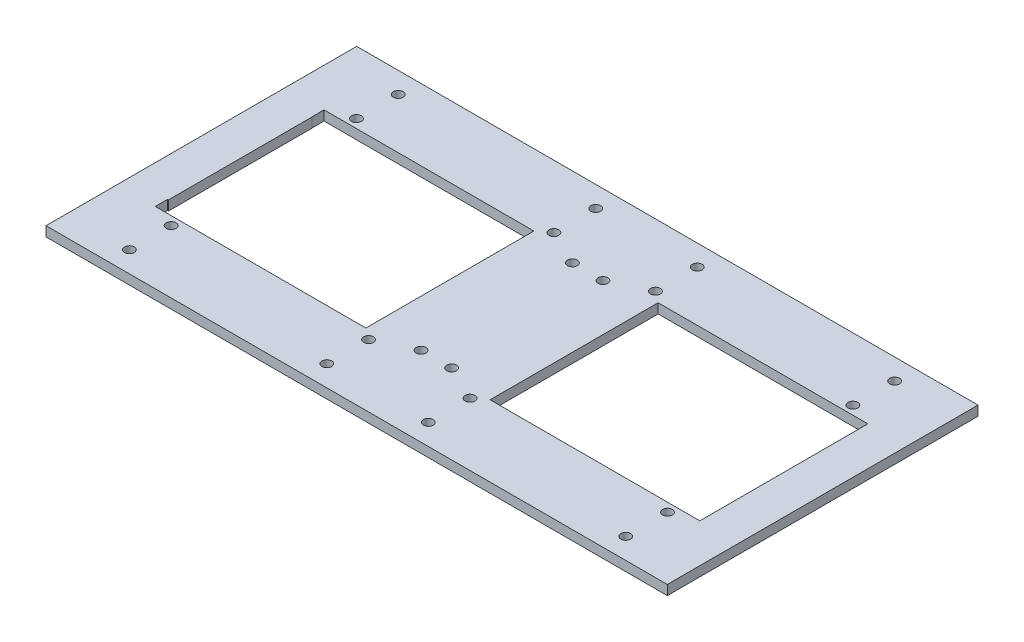
from build123d import *

# Parameters (mm, degrees)
SKETCH1_W           = 203.2
SKETCH1_H           = 101.6
SKETCH1_R           = 1.6
SKETCH1_W_2         = 68.58
SKETCH1_H_2         = 54.953705786
BOSS_EXTRUDE1_DEPTH = 3.175


with BuildPart() as part:
    # Sketch1 → Boss-Extrude1 (new body)
    with BuildSketch(Plane(origin=(0, 0, 0), x_dir=(1, 0, 0), z_dir=(0, 1, 0))):
        with Locations((101.6, -50.8)):
            Rectangle(SKETCH1_W, SKETCH1_H)
        Polygon((12.648382796, -23.323147107), (81.28, -23.323147107), (81.28, -78.276852893), (12.405089541, -78.276852893), (12.405089541, -74.276852893), (12.7, -74.276852893), (12.7, -27.323147107), (12.648382796, -27.323147107), align=None, mode=Mode.SUBTRACT)
        with Locations((20.431013284, -6.830786777)):
            Circle(SKETCH1_R, mode=Mode.SUBTRACT)
        with Locations((20.431013284, -20.49236033)):
            Circle(SKETCH1_R, mode=Mode.SUBTRACT)
        with Locations((85, -6.830786777)):
            Circle(SKETCH1_R, mode=Mode.SUBTRACT)
        with Locations((96.6, -26.05)):
            Circle(SKETCH1_R, mode=Mode.SUBTRACT)
        with Locations((85, -20.49236033)):
            Circle(SKETCH1_R, mode=Mode.SUBTRACT)
        with Locations((20.431013284, -94.769213223)):
            Circle(SKETCH1_R, mode=Mode.SUBTRACT)
        with Locations((20.431013284, -81.10763967)):
            Circle(SKETCH1_R, mode=Mode.SUBTRACT)
        with Locations((156.21, -50.8)):
            Rectangle(SKETCH1_W_2, SKETCH1_H_2, mode=Mode.SUBTRACT)
        with Locations((106.6, -26.05)):
            Circle(SKETCH1_R, mode=Mode.SUBTRACT)
        with Locations((118.2, -20.49236033)):
            Circle(SKETCH1_R, mode=Mode.SUBTRACT)
        with Locations((118.2, -6.830786777)):
            Circle(SKETCH1_R, mode=Mode.SUBTRACT)
        with Locations((85, -81.10763967)):
            Circle(SKETCH1_R, mode=Mode.SUBTRACT)
        with Locations((96.6, -75.55)):
            Circle(SKETCH1_R, mode=Mode.SUBTRACT)
        with Locations((85, -94.769213223)):
            Circle(SKETCH1_R, mode=Mode.SUBTRACT)
        with Locations((182.768986716, -20.49236033)):
            Circle(SKETCH1_R, mode=Mode.SUBTRACT)
        with Locations((182.768986716, -6.830786777)):
            Circle(SKETCH1_R, mode=Mode.SUBTRACT)
        with Locations((118.2, -94.769213223)):
            Circle(SKETCH1_R, mode=Mode.SUBTRACT)
        with Locations((106.6, -75.55)):
            Circle(SKETCH1_R, mode=Mode.SUBTRACT)
        with Locations((118.2, -81.10763967)):
            Circle(SKETCH1_R, mode=Mode.SUBTRACT)
        with Locations((182.768986716, -81.10763967)):
            Circle(SKETCH1_R, mode=Mode.SUBTRACT)
        with Locations((182.768986716, -94.769213223)):
            Circle(SKETCH1_R, mode=Mode.SUBTRACT)
    extrude(amount=-BOSS_EXTRUDE1_DEPTH)


solid = part.part
